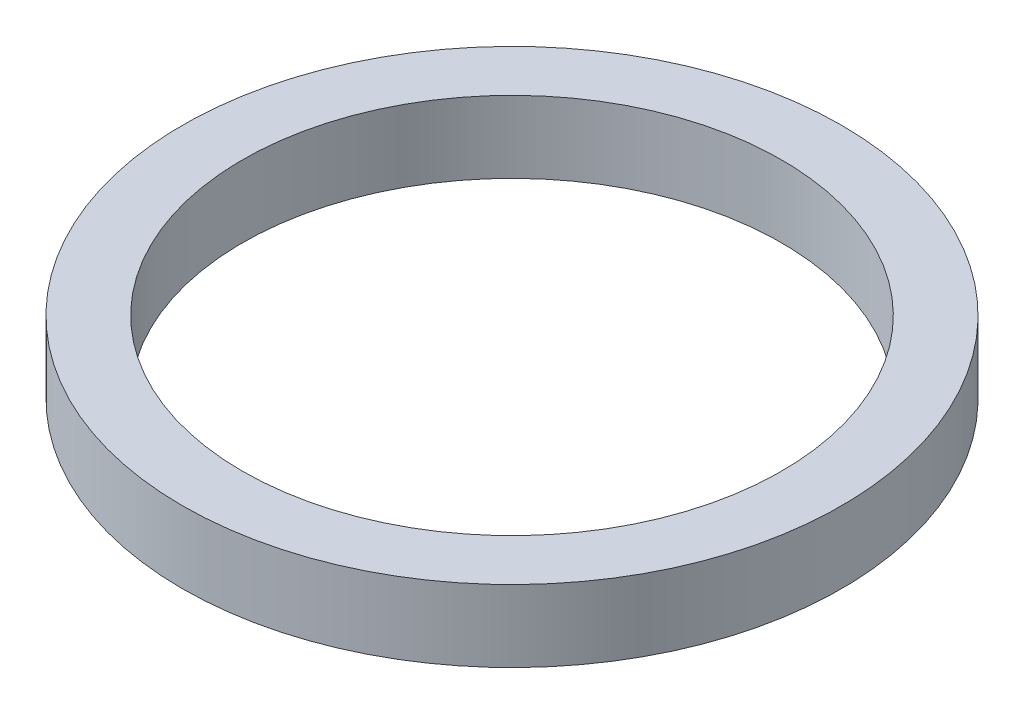
from build123d import *

# Parameters (mm, degrees)
SKETCH1_R           = 55
BOSS_EXTRUDE1_DEPTH = 12
SKETCH2_R           = 45
CUT_EXTRUDE1_DEPTH  = 79.70196948


with BuildPart() as part:
    # Sketch1 → Boss-Extrude1 (new body)
    with BuildSketch(Plane(origin=(0, 0, 0), x_dir=(1, 0, 0), z_dir=(0, 1, 0))):
        Circle(SKETCH1_R)
    extrude(amount=BOSS_EXTRUDE1_DEPTH)

    # Sketch2 → Cut-Extrude1 (cut, through all)
    with BuildSketch(Plane(origin=(0, 0, 0), x_dir=(1, 0, 0), z_dir=(0, 1, 0))):
        Circle(SKETCH2_R)
    extrude(amount=CUT_EXTRUDE1_DEPTH, mode=Mode.SUBTRACT)


solid = part.part
